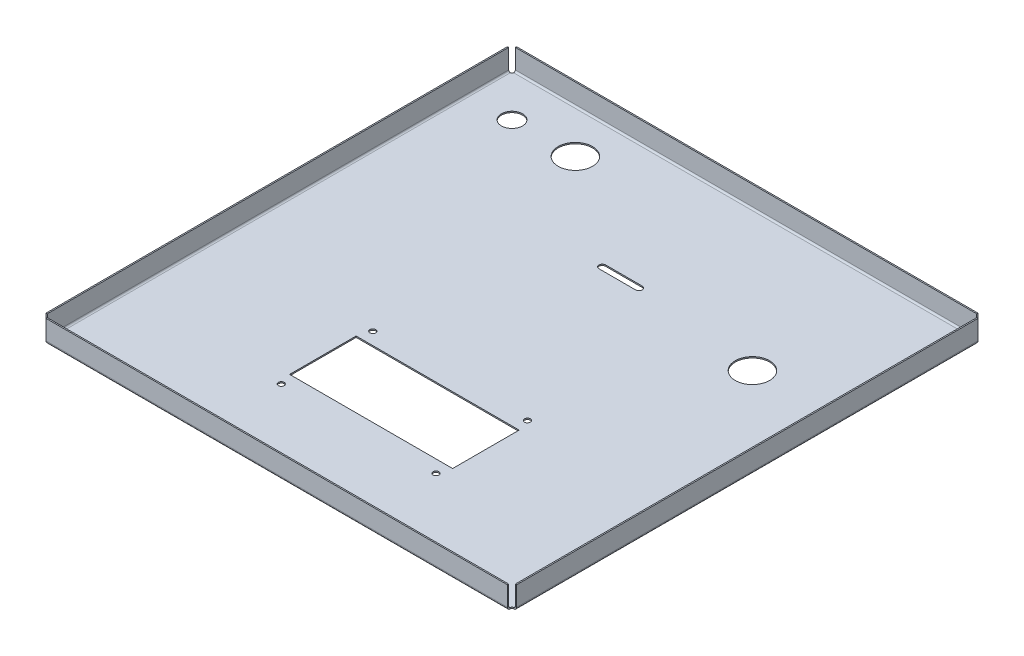
from build123d import *

# Parameters (mm, degrees)
SKETCH1_W                 = 279.4
SKETCH1_H                 = 279.4
BASE_FLANGE1_DEPTH        = 0.75946
SKETCH4_R                 = 1
CUT_EXTRUDE1_DEPTH        = 396.131999184
EDGE_FLANGE1_DEPTH        = 277.4
EDGE_FLANGE1_BEND_DEPTH   = 277.4
EDGE_FLANGE1_BEND_2_DEPTH = 277.4
EDGE_FLANGE1_BEND_3_DEPTH = 277.4
CUT_EXTRUDE2_REACH        = 399.847
SKETCH17_R                = 6.35
SKETCH17_R_2              = 10.31875
SKETCH17_W                = 98
SKETCH17_H                = 40
SKETCH19_R                = 1.75
CUT_EXTRUDE4_DEPTH        = 398.847258327


# Sheet-metal steps are written as plain solids
with BuildPart() as part:
    # Sketch1 → Base-Flange1 (new body)
    with BuildSketch(Plane(origin=(0, 0, 0), x_dir=(1, 0, 0), z_dir=(0, 1, 0))):
        with Locations((139.7, 139.7)):
            Rectangle(SKETCH1_W, SKETCH1_H)
    extrude(amount=BASE_FLANGE1_DEPTH)

    # Sketch4 → Cut-Extrude1 (cut, through all)
    with BuildSketch(Plane(origin=(0, 0.75946, 0), x_dir=(1, 0, 0), z_dir=(0, 1, 0))):
        Circle(SKETCH4_R)
        with Locations((0, 279.4)):
            Circle(SKETCH4_R)
        with Locations((279.4, 279.4)):
            Circle(SKETCH4_R)
        with Locations((279.4, 0)):
            Circle(SKETCH4_R)
    extrude(amount=-CUT_EXTRUDE1_DEPTH, mode=Mode.SUBTRACT)

    # Edge-Flange1 section (across the edge) → Edge-Flange1 (add)
    with BuildSketch(Plane(origin=(278.4, 0.75946, -280.4), x_dir=(0, 0, 1), z_dir=(-1, 0, 0))):
        with BuildLine():
            Line((-0.75946, 1), (-0.75946, 12.7))
            Line((-0.75946, 12.7), (0, 12.7))
            Line((0, 12.7), (0, 1))
            ThreePointArc((0, 1), (0.292893219, 0.292893219), (1, 0))
            Line((1, 0), (1, -0.75946))
            ThreePointArc((1, -0.75946), (-0.244126097, -0.244126097), (-0.75946, 1))
        make_face()
    extrude(amount=EDGE_FLANGE1_DEPTH)

    # Edge-Flange1 section 2 (across the edge) → Edge-Flange1 bend (add)
    with BuildSketch(Plane(origin=(-1, 0.75946, -278.4), x_dir=(1, 0, 0), z_dir=(0, 0, 1))):
        with BuildLine():
            Line((-0.75946, 1), (-0.75946, 12.7))
            Line((-0.75946, 12.7), (0, 12.7))
            Line((0, 12.7), (0, 1))
            ThreePointArc((0, 1), (0.292893219, 0.292893219), (1, 0))
            Line((1, 0), (1, -0.75946))
            ThreePointArc((1, -0.75946), (-0.244126097, -0.244126097), (-0.75946, 1))
        make_face()
    extrude(amount=EDGE_FLANGE1_BEND_DEPTH)

    # Edge-Flange1 section 3 (across the edge) → Edge-Flange1 bend 2 (add)
    with BuildSketch(Plane(origin=(1, 0.75946, 1), x_dir=(0, 0, -1), z_dir=(1, 0, 0))):
        with BuildLine():
            Line((-0.75946, 1), (-0.75946, 12.7))
            Line((-0.75946, 12.7), (0, 12.7))
            Line((0, 12.7), (0, 1))
            ThreePointArc((0, 1), (0.292893219, 0.292893219), (1, 0))
            Line((1, 0), (1, -0.75946))
            ThreePointArc((1, -0.75946), (-0.244126097, -0.244126097), (-0.75946, 1))
        make_face()
    extrude(amount=EDGE_FLANGE1_BEND_2_DEPTH)

    # Edge-Flange1 section 4 (across the edge) → Edge-Flange1 bend 3 (add)
    with BuildSketch(Plane(origin=(280.4, 0.75946, -1), x_dir=(-1, 0, 0), z_dir=(0, 0, -1))):
        with BuildLine():
            Line((-0.75946, 1), (-0.75946, 12.7))
            Line((-0.75946, 12.7), (0, 12.7))
            Line((0, 12.7), (0, 1))
            ThreePointArc((0, 1), (0.292893219, 0.292893219), (1, 0))
            Line((1, 0), (1, -0.75946))
            ThreePointArc((1, -0.75946), (-0.244126097, -0.244126097), (-0.75946, 1))
        make_face()
    extrude(amount=EDGE_FLANGE1_BEND_3_DEPTH)

    # Sketch17 → Cut-Extrude2 (cut, up to next)
    with BuildSketch(Plane.XZ, mode=Mode.PRIVATE) as cut_extrude2_sk1:
        with Locations(Location((25, -254.4, 0), (0, 0, 270))):
            Circle(SKETCH17_R)
    cut_extrude2_tool1 = extrude(cut_extrude2_sk1.sketch, amount=-CUT_EXTRUDE2_REACH, mode=Mode.PRIVATE) & part.part
    # Sketch17 → Cut-Extrude2 (cut, up to next)
    with BuildSketch(Plane.XZ, mode=Mode.PRIVATE) as cut_extrude2_sk2:
        with Locations(Location((63.1, -254.4, 0), (0, 0, 270))):
            Circle(SKETCH17_R_2)
    cut_extrude2_tool2 = extrude(cut_extrude2_sk2.sketch, amount=-CUT_EXTRUDE2_REACH, mode=Mode.PRIVATE) & part.part
    # Sketch17 → Cut-Extrude2 (cut, up to next)
    with BuildSketch(Plane.XZ, mode=Mode.PRIVATE) as cut_extrude2_sk3:
        with Locations(Location((227.84, -196.11, 0), (0, 0, 270))):
            Circle(SKETCH17_R_2)
    cut_extrude2_tool3 = extrude(cut_extrude2_sk3.sketch, amount=-CUT_EXTRUDE2_REACH, mode=Mode.PRIVATE) & part.part
    # Sketch17 → Cut-Extrude2 (cut, up to next)
    with BuildSketch(Plane.XZ, mode=Mode.PRIVATE) as cut_extrude2_sk4:
        with Locations((139.7, -75)):
            Rectangle(SKETCH17_W, SKETCH17_H)
    cut_extrude2_tool4 = extrude(cut_extrude2_sk4.sketch, amount=-CUT_EXTRUDE2_REACH, mode=Mode.PRIVATE) & part.part
    # Sketch17 → Cut-Extrude2 (cut, up to next)
    with BuildSketch(Plane.XZ, mode=Mode.PRIVATE) as cut_extrude2_sk5:
        with BuildLine():
            Line((128.7, -203), (150.7, -203))
            ThreePointArc((150.7, -203), (152.7, -205), (150.7, -207))
            Line((150.7, -207), (128.7, -207))
            ThreePointArc((128.7, -207), (126.7, -205), (128.7, -203))
        make_face()
    cut_extrude2_tool5 = extrude(cut_extrude2_sk5.sketch, amount=-CUT_EXTRUDE2_REACH, mode=Mode.PRIVATE) & part.part
    add(cut_extrude2_tool1.solids().sort_by_distance((25, 0, -254.4))[0], mode=Mode.SUBTRACT)
    add(cut_extrude2_tool2.solids().sort_by_distance((63.1, 0, -254.4))[0], mode=Mode.SUBTRACT)
    add(cut_extrude2_tool3.solids().sort_by_distance((227.84, 0, -196.11))[0], mode=Mode.SUBTRACT)
    add(cut_extrude2_tool4.solids().sort_by_distance((139.7, 0, -75))[0], mode=Mode.SUBTRACT)
    add(cut_extrude2_tool5.solids().sort_by_distance((139.7, 0, -205))[0], mode=Mode.SUBTRACT)

    # Sketch19 → Cut-Extrude4 (cut, through all)
    with BuildSketch(Plane.XZ):
        with Locations(Location((93.2, -47.5, 0), (0, 0, 270))):
            Circle(SKETCH19_R)
        with Locations(Location((186.2, -47.5, 0), (0, 0, 270))):
            Circle(SKETCH19_R)
        with Locations(Location((186.2, -102.5, 0), (0, 0, 270))):
            Circle(SKETCH19_R)
        with Locations(Location((93.2, -102.5, 0), (0, 0, 270))):
            Circle(SKETCH19_R)
    extrude(amount=-CUT_EXTRUDE4_DEPTH, mode=Mode.SUBTRACT)


solid = part.part
